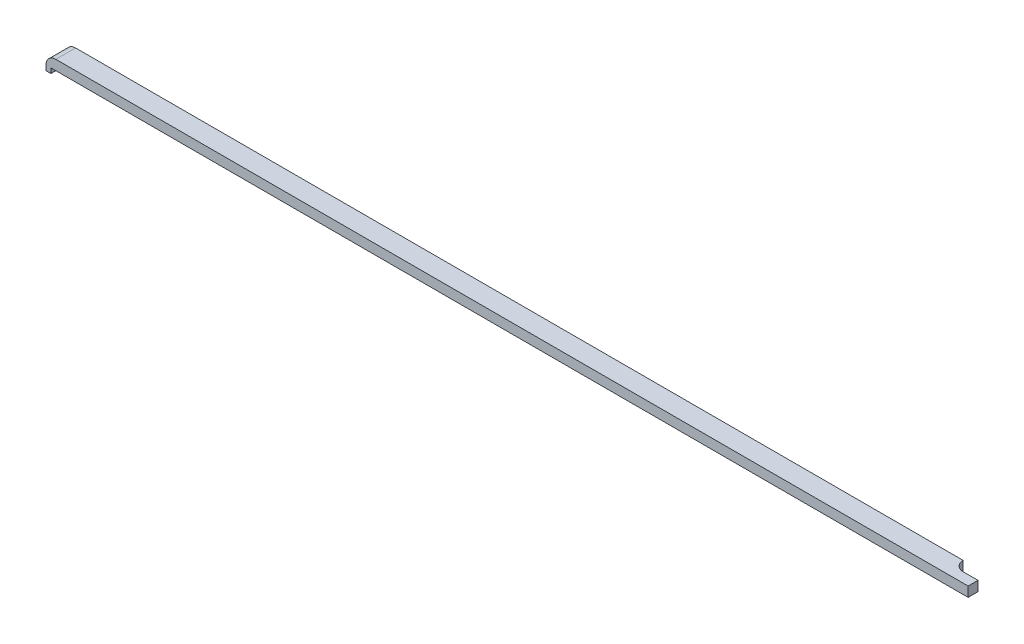
from build123d import *

# Parameters (mm, degrees)
SKETCH_1_W          = 187
SKETCH_1_H          = 2
EXTRUDE_1_DEPTH     = 4
SKETCH_2_W          = 1
SKETCH_2_H          = 4
EXTRUDE_1_2_DEPTH   = 1
FILLET_1_R          = 2
SKETCH_3_W          = 5
SKETCH_3_H          = 2
CUT_EXTRUDE_1_DEPTH = 188.053468292
FILLET_2_R          = 2


with BuildPart() as part:
    # 草图1 → Extrude 1 (new body)
    with BuildSketch(Plane.XY):
        with Locations((93.5, -1)):
            Rectangle(SKETCH_1_W, SKETCH_1_H)
    extrude(amount=EXTRUDE_1_DEPTH)

    # 草图2 → Extrude 1 2 (add)
    with BuildSketch(Plane.XZ.offset(2)):
        with Locations((0.5, 2)):
            Rectangle(SKETCH_2_W, SKETCH_2_H)
    extrude(amount=EXTRUDE_1_2_DEPTH)

    # 圆角1
    fillet_1_edges = [part.edges().sort_by_distance(p)[0] for p in [
        (0, 0, 2),
    ]]
    fillet(fillet_1_edges, radius=FILLET_1_R)

    # 草图3 → 切除-拉伸1 (cut, through all)
    with BuildSketch(Plane.XZ.offset(2)):
        with Locations((184.5, 1)):
            Rectangle(SKETCH_3_W, SKETCH_3_H)
    extrude(amount=-CUT_EXTRUDE_1_DEPTH, mode=Mode.SUBTRACT)

    # 圆角2
    fillet_2_edges = [part.edges().sort_by_distance(p)[0] for p in [
        (182, -1, 2),
    ]]
    fillet(fillet_2_edges, radius=FILLET_2_R - 0.0001)  # a hair under: the kernel refuses the full size


solid = part.part
